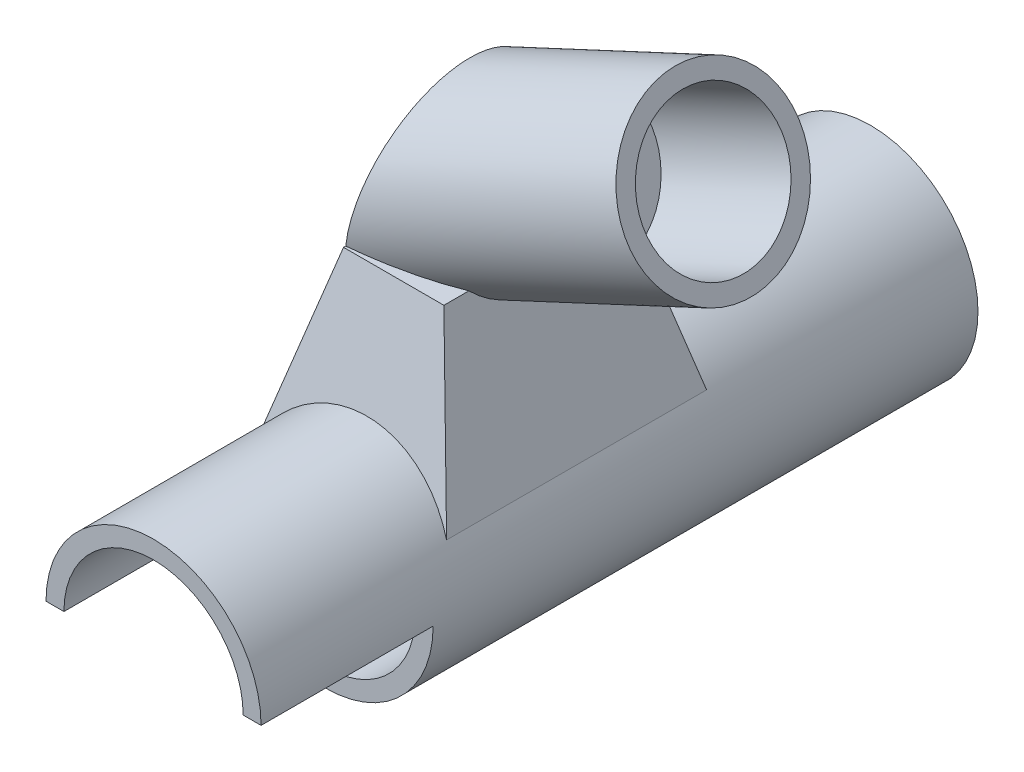
from build123d import *

# Parameters (mm, degrees)
BOSS_EXTRUDE1_DEPTH      = 54
BOSS_EXTRUDE1_DEPTH_BACK = 46
SKETCH1_R                = 15
BOSS_EXTRUDE3_REACH      = 99.568
SKETCH20_R               = 12.5
SKETCH20_R_2             = 10
SKETCH20_3_R             = 10
CUT_EXTRUDE2_DEPTH       = 20
SKETCH22_R               = 12.5
CUT_EXTRUDE3_DEPTH       = 95
CUT_EXTRUDE6_DEPTH       = 24
CUT_EXTRUDE7_REACH       = 125.735
SKETCH23_R               = 2.435


with BuildPart() as part:
    # Sketch1 → Boss-Extrude1 (new, two sides: drawn at the far end of the back side and taken through both)
    with BuildSketch(Plane.XY.offset(-BOSS_EXTRUDE1_DEPTH_BACK)):
        Circle(SKETCH1_R)
    extrude(amount=BOSS_EXTRUDE1_DEPTH + BOSS_EXTRUDE1_DEPTH_BACK)

    # Loft1: read off the stored shape, not the designer's step
    # Loft1: loft between two sections, ruled curve by curve
    loft1_from = [
        Edge.make_line((-13.008298755, 7.468879668, 18.132780083), (-13.008298755, 7.468879668, -18.132780083)),
        Edge.make_line((-13.008298755, 7.468879668, -18.132780083), (13.008298755, 7.468879668, -18.132780083)),
        Edge.make_line((13.008298755, 7.468879668, 18.132780083), (-13.008298755, 7.468879668, 18.132780083)),
        Edge.make_line((13.008298755, 7.468879668, -18.132780083), (13.008298755, 7.468879668, 18.132780083)),
    ]
    loft1_to = [
        Edge.make_line((-7, 30, 12.5), (-7, 30, -12.5)),
        Edge.make_line((-7, 30, -12.5), (7, 30, -12.5)),
        Edge.make_line((7, 30, 12.5), (-7, 30, 12.5)),
        Edge.make_line((7, 30, -12.5), (7, 30, 12.5)),
    ]
    loft1 = Solid(Shell([*[Face.make_surface_from_curves(loft1_from[k], loft1_to[k]) for k in range(4)], Face(Wire(loft1_from)), Face(Wire(loft1_to))]))
    add(loft1)

    # Boss-Extrude3: up to this plane
    boss_extrude3_end = Plane(origin=(-14.004149378, 3.734439834, 0), z_dir=(0.9662349396012463, -0.25766265056033255, 0))
    # Sketch20 → Boss-Extrude3 (add, up to the surface)
    with BuildSketch(Plane(origin=(32.065513698, 51.244565683, 0), x_dir=(0, 0, -1), z_dir=(0.9063077870366495, 0.4226182617407006, 0)), mode=Mode.PRIVATE) as boss_extrude3_sk1:
        with Locations(Location((0, 0, 0), (0, 0, 90))):
            Circle(SKETCH20_R)
        Circle(SKETCH20_R_2, mode=Mode.SUBTRACT)
    boss_extrude3_tool1 = split(extrude(boss_extrude3_sk1.sketch, amount=-BOSS_EXTRUDE3_REACH, mode=Mode.PRIVATE), bisect_by=boss_extrude3_end, keep=Keep.BOTH, mode=Mode.PRIVATE)
    add(boss_extrude3_tool1.solids().sort_by_distance((37.198824, 40.236147, 0))[0])
    # Sketch20 → Boss-Extrude3 (add, up to the surface)
    with BuildSketch(Plane(origin=(32.065513698, 51.244565683, 0), x_dir=(0, 0, -1), z_dir=(0.9063077870366495, 0.4226182617407006, 0)), mode=Mode.PRIVATE) as boss_extrude3_sk2:
        Circle(SKETCH20_R_2)
    boss_extrude3_tool2 = split(extrude(boss_extrude3_sk2.sketch, amount=-BOSS_EXTRUDE3_REACH, mode=Mode.PRIVATE), bisect_by=boss_extrude3_end, keep=Keep.BOTH, mode=Mode.PRIVATE)
    add(boss_extrude3_tool2.solids().sort_by_distance((32.065514, 51.244566, 0))[0])

    # Sketch20<3> → Cut-Extrude2 (cut)
    with BuildSketch(Plane(origin=(32.065513698, 51.244565683, 0), x_dir=(0, 0, -1), z_dir=(0.9063077870366495, 0.4226182617407006, 0))):
        with Locations(Location((0, 0, 0), (0, 0, 90))):
            Circle(SKETCH20_3_R)
    extrude(amount=-CUT_EXTRUDE2_DEPTH, mode=Mode.SUBTRACT)

    # Sketch22 → Cut-Extrude3 (cut)
    with BuildSketch(Plane(origin=(0, 0, -46), x_dir=(-1, 0, 0), z_dir=(0, 0, -1))):
        Circle(SKETCH22_R)
    extrude(amount=-CUT_EXTRUDE3_DEPTH, mode=Mode.SUBTRACT)

    # Sketch22<3> → Cut-Extrude6 (cut)
    with BuildSketch(Plane(origin=(0, 0, -46), x_dir=(-1, 0, 0), z_dir=(0, 0, -1))):
        with BuildLine():
            ThreePointArc((12.5, 0), (0, -12.5), (-12.5, 0))
            Line((-12.5, 0), (-15, 0))
            ThreePointArc((-15, 0), (0, -15), (15, 0))
            Line((15, 0), (12.5, 0))
        make_face()
    extrude(amount=-CUT_EXTRUDE6_DEPTH, mode=Mode.SUBTRACT)

    # Sketch23 → Cut-Extrude7 (cut, up to next)
    with BuildSketch(Plane.XY.offset(54), mode=Mode.PRIVATE) as cut_extrude7_sk1:
        with Locations((2.172182, -4.201728854)):
            Circle(SKETCH23_R)
    cut_extrude7_tool1 = extrude(cut_extrude7_sk1.sketch, amount=-CUT_EXTRUDE7_REACH, mode=Mode.PRIVATE) & part.part
    add(cut_extrude7_tool1.solids().sort_by_distance((2.172182, -4.201729, 54))[0], mode=Mode.SUBTRACT)


with BuildPart() as body_2:
    # Mirror1: mirrored copy
    add(part.part.mirror(Plane.XY.offset(54)))


solid = body_2.part
